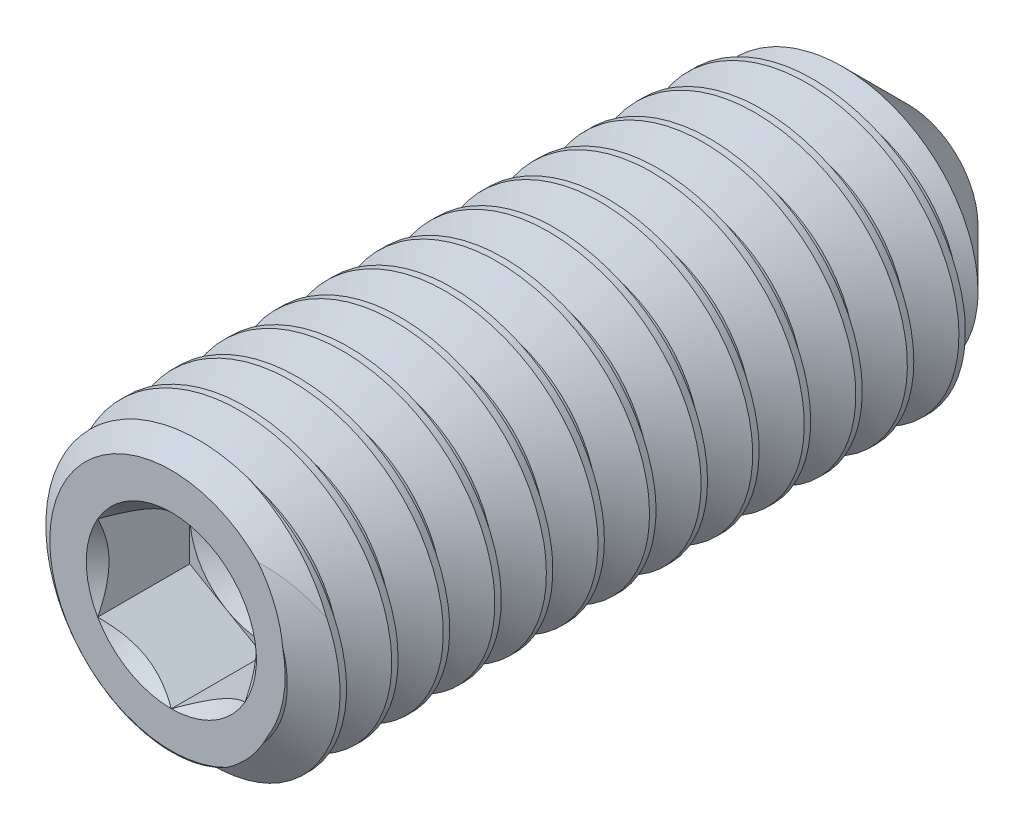
from build123d import *

# Parameters (mm, degrees)
CUT_EXTRUDE1_DEPTH = 1.25
CUT_SWEEP1_PITCH   = 0.7


with BuildPart() as part:
    # Sketch11 → Revolve1 (revolve)
    with BuildSketch(Plane(origin=(0, 0, 0), x_dir=(0, 0, -1), z_dir=(1, 0, 0)), mode=Mode.PRIVATE) as revolve1_sk:
        Polygon((-5, 0), (-5, 1.65), (-4.754927362, 2), (3.95, 2), (5, 0.95), (4.429182412, 0), align=None)
    revolve(revolve1_sk.sketch.rotate(Axis((0, 0, -4.429182412), (0, 0, -1)), 180), axis=Axis((0, 0, -4.429182412), (0, 0, -1)))

    # Sketch2 → Cut-Extrude1 (cut)
    with BuildSketch(Plane.XY.offset(5)):
        Polygon((0, 1.154700538), (-1, 0.577350269), (-1, -0.577350269), (0, -1.154700538), (1, -0.577350269), (1, 0.577350269), align=None)
    extrude(amount=-CUT_EXTRUDE1_DEPTH, mode=Mode.SUBTRACT)

    # Cut-Extrude2 cone 1 section (through the dimple's axis) → Cut-Extrude2 (revolve, cut)
    with BuildSketch(Plane(origin=(0, 0, 5), x_dir=(0, -1, 0), z_dir=(1, 0, 0))):
        Polygon((0, 0), (1.154700538, 0), (0, 1.154700538), align=None)
    revolve(axis=Axis((0, 0, 5), (0, 0, -1)), mode=Mode.SUBTRACT)

    # Cut-Extrude3 cone 1 section (through the dimple's axis) → Cut-Extrude3 (revolve, cut)
    with BuildSketch(Plane(origin=(0, 0, 3.75), x_dir=(0, -1, 0), z_dir=(1, 0, 0))):
        Polygon((0, 0), (1, 0), (0, 0.577350269), align=None)
    revolve(axis=Axis((0, 0, 3.75), (0, 0, -1)), mode=Mode.SUBTRACT)

    # Cut-Sweep1: the profile of Sketch6 screwed along a right-hand helix of 15.714286 turns, 6 arcs to a turn; built about Z, then put on its axis
    cut_sweep1_z = Axis((0, 0, 0), (0, 0, 1))
    cut_sweep1_corners = [(1.545336663, 0, -0.2625), (2.037888611, 0, 0.021875), (2.037888611, 0, -0.634375), (1.545336663, 0, -0.35)]
    with BuildLine(mode=Mode.PRIVATE) as cut_sweep1_profile:
        Line(cut_sweep1_corners[0], cut_sweep1_corners[1])
        Line(cut_sweep1_corners[1], cut_sweep1_corners[2])
        Line(cut_sweep1_corners[2], cut_sweep1_corners[3])
        Line(cut_sweep1_corners[3], cut_sweep1_corners[0])
    cut_sweep1_cap = Face(cut_sweep1_profile.wire())
    cut_sweep1_turn_angles = [0, 30, 60, 90, 120, 150, 180, 210, 240, 270, 300, 330, 360]
    cut_sweep1_turn_weights = [1, 0.8660254037844387, 1, 0.8660254037844387, 1, 0.8660254037844387, 1, 0.8660254037844387, 1, 0.8660254037844387, 1, 0.8660254037844387, 1]
    cut_sweep1_turn_rails = [Edge.make_bspline([Vector(p[0], p[1], 0).rotate(cut_sweep1_z, cut_sweep1_turn_angles[k]) / cut_sweep1_turn_weights[k] + Vector(0, 0, p[2] + CUT_SWEEP1_PITCH * cut_sweep1_turn_angles[k] / 360) for k in range(13)], [0, 0, 0, 1, 1, 2, 2, 3, 3, 4, 4, 5, 5, 6, 6, 6], 2, cut_sweep1_turn_weights) for p in cut_sweep1_corners]
    cut_sweep1_turn_sides = [Face.make_surface_from_curves(cut_sweep1_turn_rails[p[0]], cut_sweep1_turn_rails[p[1]]) for p in [(0, 1), (1, 2), (2, 3), (3, 0)]]
    cut_sweep1_last_angles = [5400, 5430, 5460, 5490, 5520, 5550, 5580, 5610, 5640, 5648.571428571, 5657.142857143]
    cut_sweep1_last_weights = [1, 0.8660254037844387, 1, 0.8660254037844387, 1, 0.8660254037844387, 1, 0.8660254037844387, 1, 0.9888308262251289, 1]
    cut_sweep1_last_rails = [Edge.make_bspline([Vector(p[0], p[1], 0).rotate(cut_sweep1_z, cut_sweep1_last_angles[k]) / cut_sweep1_last_weights[k] + Vector(0, 0, p[2] + CUT_SWEEP1_PITCH * cut_sweep1_last_angles[k] / 360) for k in range(11)], [0, 0, 0, 1, 1, 2, 2, 3, 3, 4, 4, 5, 5, 5], 2, cut_sweep1_last_weights) for p in cut_sweep1_corners]
    cut_sweep1_last_sides = [Face.make_surface_from_curves(cut_sweep1_last_rails[p[0]], cut_sweep1_last_rails[p[1]]) for p in [(0, 1), (1, 2), (2, 3), (3, 0)]]
    cut_sweep1 = Plane(origin=(0, 0, -5), x_dir=(0, 1, 0), z_dir=(0, 0, 1)) * Solid(Shell([*[p.moved(Location((0, 0, CUT_SWEEP1_PITCH * i))) for i in range(15) for p in cut_sweep1_turn_sides], *cut_sweep1_last_sides, cut_sweep1_cap, cut_sweep1_cap.rotate(cut_sweep1_z, 5657.142857143).moved(Location((0, 0, CUT_SWEEP1_PITCH * 5657.142857143 / 360)))]))
    add(cut_sweep1, mode=Mode.SUBTRACT)


solid = part.part
